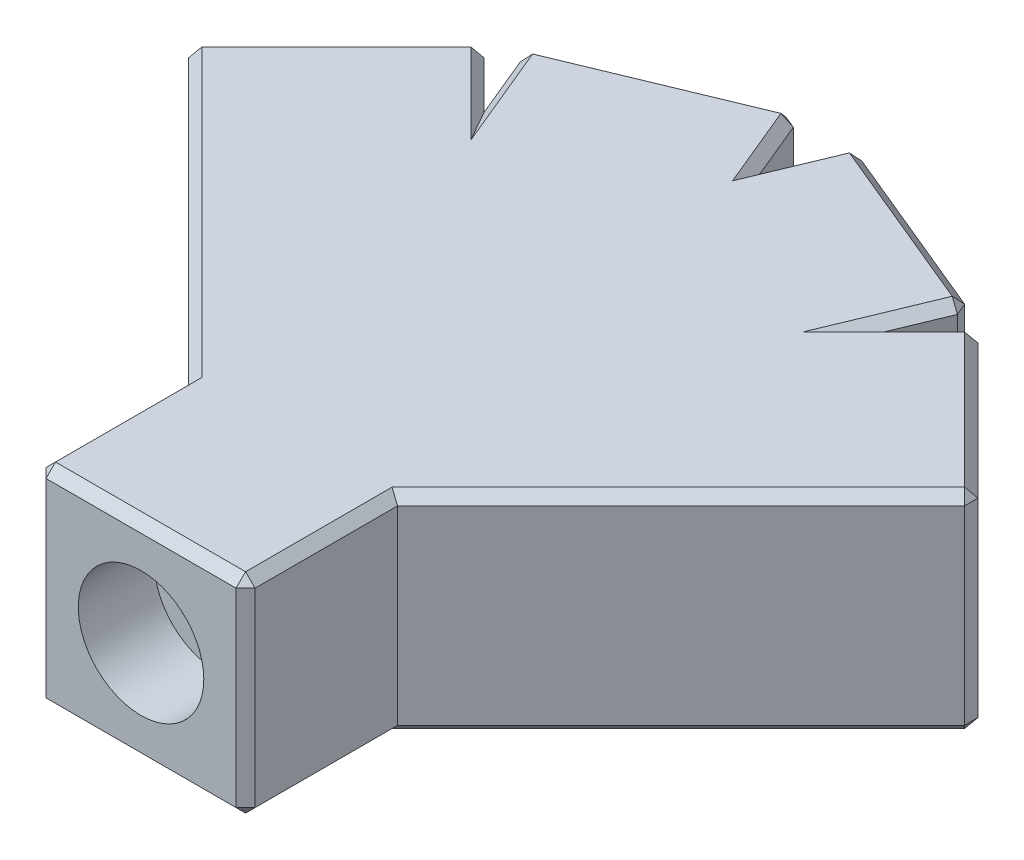
from build123d import *

# Parameters (mm, degrees)
BOSS_EXTRUDE1_DEPTH = 11
SKETCH5_R           = 1.25
CUT_EXTRUDE3_DEPTH  = 21
SKETCH6_R           = 1.25
CUT_EXTRUDE4_DEPTH  = 14
SKETCH7_R           = 1.25
CUT_EXTRUDE5_DEPTH  = 14
SKETCH8_R           = 1.25
CUT_EXTRUDE6_DEPTH  = 21
SKETCH9_W           = 11
SKETCH9_H           = 11
BOSS_EXTRUDE2_DEPTH = 8
SKETCH10_R          = 1.25
CUT_EXTRUDE7_DEPTH  = 18
SKETCH12_R          = 3.302
CUT_EXTRUDE9_DEPTH  = 4
SKETCH18_W          = 11
SKETCH18_H          = 11
SKETCH18_R          = 3.302
BOSS_EXTRUDE3_DEPTH = 4
SKETCH19_W          = 11
SKETCH19_H          = 11
SKETCH19_R          = 3.302
BOSS_EXTRUDE4_DEPTH = 4
SKETCH20_W          = 11
SKETCH20_H          = 11
SKETCH20_R          = 3.302
BOSS_EXTRUDE5_DEPTH = 4
SKETCH22_W          = 11
SKETCH22_H          = 11
SKETCH22_R          = 3.302
BOSS_EXTRUDE7_DEPTH = 4
CHAMFER1_SIZE       = 0.5


with BuildPart() as part:
    # Sketch2 → Boss-Extrude1 (new body)
    with BuildSketch(Plane(origin=(0, 0, 0), x_dir=(1, 0, 0), z_dir=(0, 1, 0))):
        Polygon((0, 24.4285418), (-10.162674858, 20.219024044), (-17.940849451, 12.440849451), (-5.5, 0), (5.5, 0), (17.940849451, 12.440849451), (10.162674858, 20.219024044), align=None)
    extrude(amount=BOSS_EXTRUDE1_DEPTH)

    # Sketch5 → Cut-Extrude3 (cut)
    with BuildSketch(Plane(origin=(15.190849451, 0, -15.190849451), x_dir=(-0.7071067811865466, 0, -0.7071067811865486), z_dir=(0.7071067811865486, 0, -0.7071067811865466))):
        with Locations((1.610912703, 5.5)):
            Circle(SKETCH5_R)
    extrude(amount=-CUT_EXTRUDE3_DEPTH, mode=Mode.SUBTRACT)

    # Sketch6 → Cut-Extrude4 (cut)
    with BuildSketch(Plane(origin=(8.636793781, 0, -20.85106468), x_dir=(-0.9238795325112867, 0, -0.3826834323650899), z_dir=(0.3826834323650899, 0, -0.9238795325112867))):
        with Locations((3.848398224, 5.5)):
            Circle(SKETCH6_R)
    extrude(amount=-CUT_EXTRUDE4_DEPTH, mode=Mode.SUBTRACT)

    # Sketch7 → Cut-Extrude5 (cut)
    with BuildSketch(Plane(origin=(-8.636793781, 0, -20.85106468), x_dir=(-0.9238795325112867, 0, 0.3826834323650899), z_dir=(-0.3826834323650899, 0, -0.9238795325112867))):
        with Locations((-3.848398224, 5.5)):
            Circle(SKETCH7_R)
    extrude(amount=-CUT_EXTRUDE5_DEPTH, mode=Mode.SUBTRACT)

    # Sketch8 → Cut-Extrude6 (cut)
    with BuildSketch(Plane(origin=(-15.190849451, 0, -15.190849451), x_dir=(-0.7071067811865466, 0, 0.7071067811865486), z_dir=(-0.7071067811865486, 0, -0.7071067811865466))):
        with Locations((-1.610912703, 5.5)):
            Circle(SKETCH8_R)
    extrude(amount=-CUT_EXTRUDE6_DEPTH, mode=Mode.SUBTRACT)

    # Sketch9 → Boss-Extrude2 (add)
    with BuildSketch(Plane.XY):
        with Locations((0, 5.5)):
            Rectangle(SKETCH9_W, SKETCH9_H)
    extrude(amount=BOSS_EXTRUDE2_DEPTH)

    # Sketch10 → Cut-Extrude7 (cut)
    with BuildSketch(Plane.XY.offset(8)):
        with Locations((0, 5.5)):
            Circle(SKETCH10_R)
    extrude(amount=-CUT_EXTRUDE7_DEPTH, mode=Mode.SUBTRACT)

    # Sketch12 → Cut-Extrude9 (cut)
    with BuildSketch(Plane.XY.offset(8)):
        with Locations((0, 5.5)):
            Circle(SKETCH12_R)
    extrude(amount=-CUT_EXTRUDE9_DEPTH, mode=Mode.SUBTRACT)

    # Sketch18 → Boss-Extrude3 (add)
    with BuildSketch(Plane(origin=(15.190849451, 0, -15.190849451), x_dir=(-0.7071067811865467, 0, -0.7071067811865485), z_dir=(0.7071067811865485, 0, -0.7071067811865467))):
        with Locations((1.610912703, 5.5)):
            Rectangle(SKETCH18_W, SKETCH18_H)
        with Locations((1.610912703, 5.5)):
            Circle(SKETCH18_R, mode=Mode.SUBTRACT)
    extrude(amount=BOSS_EXTRUDE3_DEPTH)

    # Sketch19 → Boss-Extrude4 (add)
    with BuildSketch(Plane(origin=(8.636793781, 0, -20.85106468), x_dir=(-0.9238795325112863, 0, -0.38268343236509095), z_dir=(0.38268343236509095, 0, -0.9238795325112863))):
        with Locations((3.848398224, 5.5)):
            Rectangle(SKETCH19_W, SKETCH19_H)
        with Locations((3.848398224, 5.5)):
            Circle(SKETCH19_R, mode=Mode.SUBTRACT)
    extrude(amount=BOSS_EXTRUDE4_DEPTH)

    # Sketch20 → Boss-Extrude5 (add)
    with BuildSketch(Plane(origin=(-8.636793781, 0, -20.85106468), x_dir=(-0.9238795325112863, 0, 0.38268343236509095), z_dir=(-0.38268343236509095, 0, -0.9238795325112863))):
        with Locations((-3.848398224, 5.5)):
            Rectangle(SKETCH20_W, SKETCH20_H)
        with Locations((-3.848398224, 5.5)):
            Circle(SKETCH20_R, mode=Mode.SUBTRACT)
    extrude(amount=BOSS_EXTRUDE5_DEPTH)

    # Sketch22 → Boss-Extrude7 (add)
    with BuildSketch(Plane(origin=(-15.190849451, 0, -15.190849451), x_dir=(-0.7071067811865465, 0, 0.7071067811865487), z_dir=(-0.7071067811865487, 0, -0.7071067811865465))):
        with Locations((-1.610912703, 5.5)):
            Rectangle(SKETCH22_W, SKETCH22_H)
        with Locations((-1.610912703, 5.5)):
            Circle(SKETCH22_R, mode=Mode.SUBTRACT)
    extrude(amount=BOSS_EXTRUDE7_DEPTH)

    # Chamfer1
    chamfer1_edges = [part.edges().sort_by_distance(p)[0] for p in [
        (16.880189279, 11, -19.158363872),
        (5.5, 11, 4),
        (0, 11, 8),
        (-5.5, 11, 4),
        (-16.880189279, 11, -19.158363872),
        (-11.57688842, 11, -21.633237606),
        (-10.928041722, 11, -22.066783109),
        (-6.612071158, 11, -26.019301052),
        (-0.765366865, 11, -26.276300865),
        (0.765366865, 11, -26.276300865),
        (6.612071158, 11, -26.019301052),
        (10.928041722, 11, -22.066783109),
        (11.57688842, 11, -21.633237606),
        (-5.5, 0, 4),
        (-5.5, 5.5, 8),
        (0, 0, 8),
        (5.5, 5.5, 8),
        (5.5, 0, 4),
        (-20.769276575, 5.5, -15.269276575),
        (-16.880189279, 0, -19.158363872),
        (-12.991101982, 5.5, -23.047451168),
        (-11.57688842, 0, -21.633237606),
        (-10.928041722, 0, -22.066783109),
        (-11.693408587, 5.5, -23.914542174),
        (-6.612071158, 0, -26.019301052),
        (-1.530733729, 5.5, -28.12405993),
        (-0.765366865, 0, -26.276300865),
        (0.765366865, 0, -26.276300865),
        (1.530733729, 5.5, -28.12405993),
        (6.612071158, 0, -26.019301052),
        (11.693408587, 5.5, -23.914542174),
        (10.928041722, 0, -22.066783109),
        (11.57688842, 0, -21.633237606),
        (12.991101982, 5.5, -23.047451168),
        (16.880189279, 0, -19.158363872),
        (20.769276575, 5.5, -15.269276575),
        (13.134638288, 11, -7.634638288),
        (-13.134638288, 11, -7.634638288),
        (-13.134638288, 0, -7.634638288),
        (13.134638288, 0, -7.634638288),
    ]]
    chamfer(chamfer1_edges, length=CHAMFER1_SIZE)


solid = part.part
